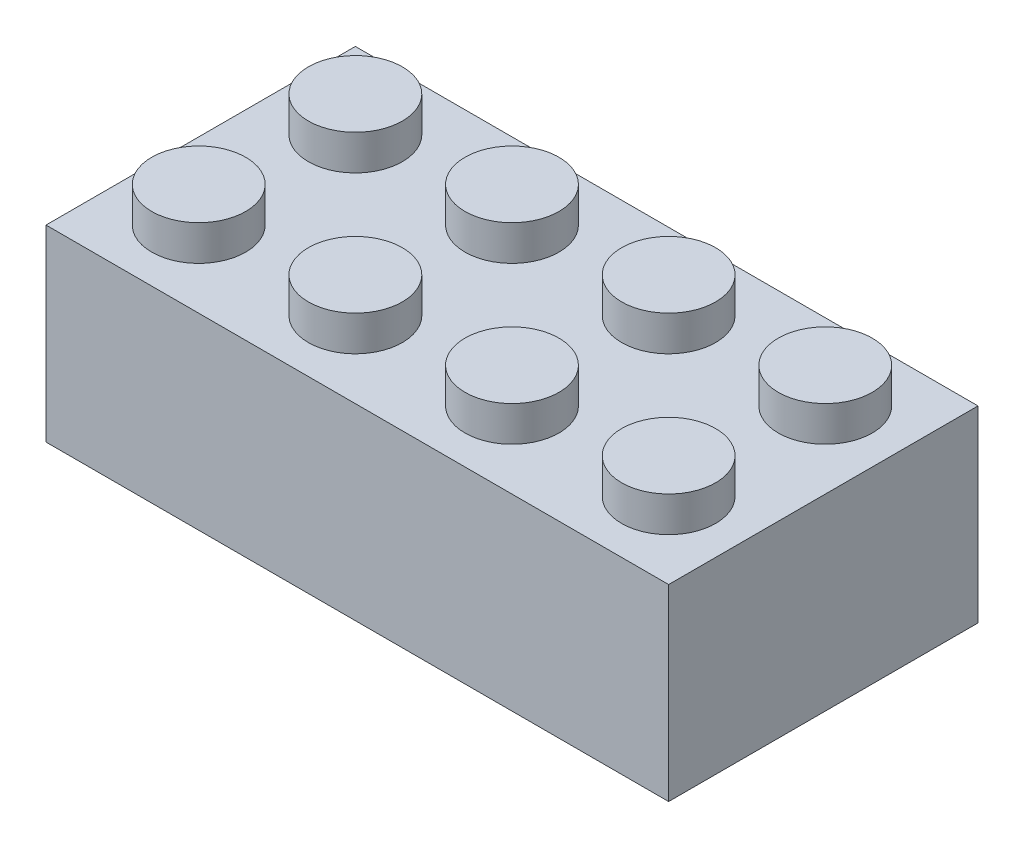
from build123d import *

# Parameters (mm, degrees)
SKETCH1_W             = 31.8
SKETCH1_H             = 15.8
BOSS_EXTRUDE1_DEPTH   = 9.6
SKETCH2_R             = 2.4
BOSS_EXTRUDE2_DEPTH   = 1.8
SKETCH4_R             = 3.25
SKETCH4_R_2           = 2.05
CUT_EXTRUDE1_DEPTH    = 8.6
LPATTERN1_START       = -4.6
LPATTERN1_OUTLINE_W   = 8.6
LPATTERN1_OUTLINE_H   = 0.2
LPATTERN1_DEPTH       = 1.2
LPATTERN1_START_2     = 3.4
LPATTERN1_2_OUTLINE_W = 8.6
LPATTERN1_2_OUTLINE_H = 0.2
LPATTERN1_2_DEPTH     = 1.2
LPATTERN1_START_3     = 11.4
LPATTERN1_3_OUTLINE_W = 8.6
LPATTERN1_3_OUTLINE_H = 0.2
LPATTERN1_3_DEPTH     = 1.2
SKETCH5_R             = 1.3
CUT_EXTRUDE2_DEPTH    = 1.7
LPATTERN9_COUNT       = 4
LPATTERN9_PITCH       = 8
LPATTERN9_COUNT_DIR2  = 2
LPATTERN9_PITCH_DIR2  = 8
BOSS_EXTRUDE3_START   = 6.3
BOSS_EXTRUDE3_DEPTH   = 6.3


# Read off the part's stored shape, not the designer's step: LPattern1
with BuildPart() as part:
    # Sketch1 → Boss-Extrude1 (new body)
    with BuildSketch(Plane(origin=(0, 0, 0), x_dir=(1, 0, 0), z_dir=(0, 1, 0))):
        Rectangle(SKETCH1_W, SKETCH1_H)
    extrude(amount=BOSS_EXTRUDE1_DEPTH)

    # Sketch2 → Boss-Extrude2 (add)
    with BuildSketch(Plane(origin=(0, 9.6, 0), x_dir=(1, 0, 0), z_dir=(0, 1, 0))):
        with Locations(Location((-12, 4, 0), (0, 0, 270))):
            Circle(SKETCH2_R)
    boss_extrude2 = extrude(amount=BOSS_EXTRUDE2_DEPTH)

    # Sketch4 → Cut-Extrude1 (cut)
    # profile 1 of 4: a face of its own
    with BuildSketch(Plane(origin=(0, 0, 0), x_dir=(1, 0, 0), z_dir=(0, 1, 0))):
        Polygon((-12.6, 6.7), (-12.6, 6.5), (-11.4, 6.5), (-11.4, 6.7), (14.7, 6.7), (14.7, 4.6), (14.5, 4.6), (14.5, 3.4), (14.7, 3.4), (14.7, -3.4), (14.5, -3.4), (14.5, -4.6), (14.7, -4.6), (14.7, -6.7), (-11.4, -6.7), (-11.4, -6.5), (-12.6, -6.5), (-12.6, -6.7), (-14.7, -6.7), (-14.7, -4.6), (-14.5, -4.6), (-14.5, -3.4), (-14.7, -3.4), (-14.7, 3.4), (-14.5, 3.4), (-14.5, 4.6), (-14.7, 4.6), (-14.7, 6.7), align=None)
        with Locations(Location((-8, 0, 0), (0, 0, 90))):
            Circle(SKETCH4_R, mode=Mode.SUBTRACT)
        with Locations(Location((0, 0, 0), (0, 0, 90))):
            Circle(SKETCH4_R, mode=Mode.SUBTRACT)
        with Locations(Location((8, 0, 0), (0, 0, 90))):
            Circle(SKETCH4_R, mode=Mode.SUBTRACT)
    # profile 2 of 4: a face of its own
    with BuildSketch(Plane(origin=(0, 0, 0), x_dir=(1, 0, 0), z_dir=(0, 1, 0))):
        with Locations(Location((8, 0, 0), (0, 0, 90))):
            Circle(SKETCH4_R_2)
    # profile 3 of 4: a face of its own
    with BuildSketch(Plane(origin=(0, 0, 0), x_dir=(1, 0, 0), z_dir=(0, 1, 0))):
        with Locations(Location((0, 0, 0), (0, 0, 90))):
            Circle(SKETCH4_R_2)
    # profile 4 of 4: a face of its own
    with BuildSketch(Plane(origin=(0, 0, 0), x_dir=(1, 0, 0), z_dir=(0, 1, 0))):
        with Locations(Location((-8, 0, 0), (0, 0, 90))):
            Circle(SKETCH4_R_2)
    extrude(amount=CUT_EXTRUDE1_DEPTH, mode=Mode.SUBTRACT)

    # LPattern1 outline → LPattern1 (add)
    with BuildSketch(Plane.YZ.offset(LPATTERN1_START)):
        with Locations((4.3, 6.6)):
            Rectangle(LPATTERN1_OUTLINE_W, LPATTERN1_OUTLINE_H)
        with Locations((4.3, -6.6)):
            Rectangle(LPATTERN1_OUTLINE_W, LPATTERN1_OUTLINE_H)
    extrude(amount=LPATTERN1_DEPTH)

    # LPattern1 2 outline → LPattern1 2 (add)
    with BuildSketch(Plane.YZ.offset(LPATTERN1_START_2)):
        with Locations((4.3, 6.6)):
            Rectangle(LPATTERN1_2_OUTLINE_W, LPATTERN1_2_OUTLINE_H)
        with Locations((4.3, -6.6)):
            Rectangle(LPATTERN1_2_OUTLINE_W, LPATTERN1_2_OUTLINE_H)
    extrude(amount=LPATTERN1_2_DEPTH)

    # LPattern1 3 outline → LPattern1 3 (add)
    with BuildSketch(Plane.YZ.offset(LPATTERN1_START_3)):
        with Locations((4.3, 6.6)):
            Rectangle(LPATTERN1_3_OUTLINE_W, LPATTERN1_3_OUTLINE_H)
        with Locations((4.3, -6.6)):
            Rectangle(LPATTERN1_3_OUTLINE_W, LPATTERN1_3_OUTLINE_H)
    extrude(amount=LPATTERN1_3_DEPTH)

    # Sketch5 → Cut-Extrude2 (cut)
    with BuildSketch(Plane.XZ.offset(-8.6)):
        with Locations(Location((-12, -4, 0), (0, 0, 270))):
            Circle(SKETCH5_R)
    cut_extrude2 = extrude(amount=-CUT_EXTRUDE2_DEPTH, mode=Mode.SUBTRACT)

    # LPattern9: Boss-Extrude2, Cut-Extrude2 4 × 2
    with Locations(*[(i * LPATTERN9_PITCH, 0, j * LPATTERN9_PITCH_DIR2) for i in range(LPATTERN9_COUNT) for j in range(LPATTERN9_COUNT_DIR2) if (i, j) != (0, 0)]):
        add(boss_extrude2)
        add(cut_extrude2, mode=Mode.SUBTRACT)

    # Sketch6 → Boss-Extrude3 (add)
    with BuildSketch(Plane.XZ.offset(-8.6).offset(BOSS_EXTRUDE3_START)):
        with BuildLine():
            Line((-0.55, 6.7), (-0.55, 3.203123476))
            ThreePointArc((-0.55, 3.203123476), (0, 3.25), (0.55, 3.203123476))
            Line((0.55, 3.203123476), (0.55, 6.7))
            Line((0.55, 6.7), (-0.55, 6.7))
        make_face()
        with BuildLine():
            Line((0.55, -6.7), (0.55, -3.203123476))
            ThreePointArc((0.55, -3.203123476), (0, -3.25), (-0.55, -3.203123476))
            Line((-0.55, -3.203123476), (-0.55, -6.7))
            Line((-0.55, -6.7), (0.55, -6.7))
        make_face()
    extrude(amount=-BOSS_EXTRUDE3_DEPTH)


solid = part.part
